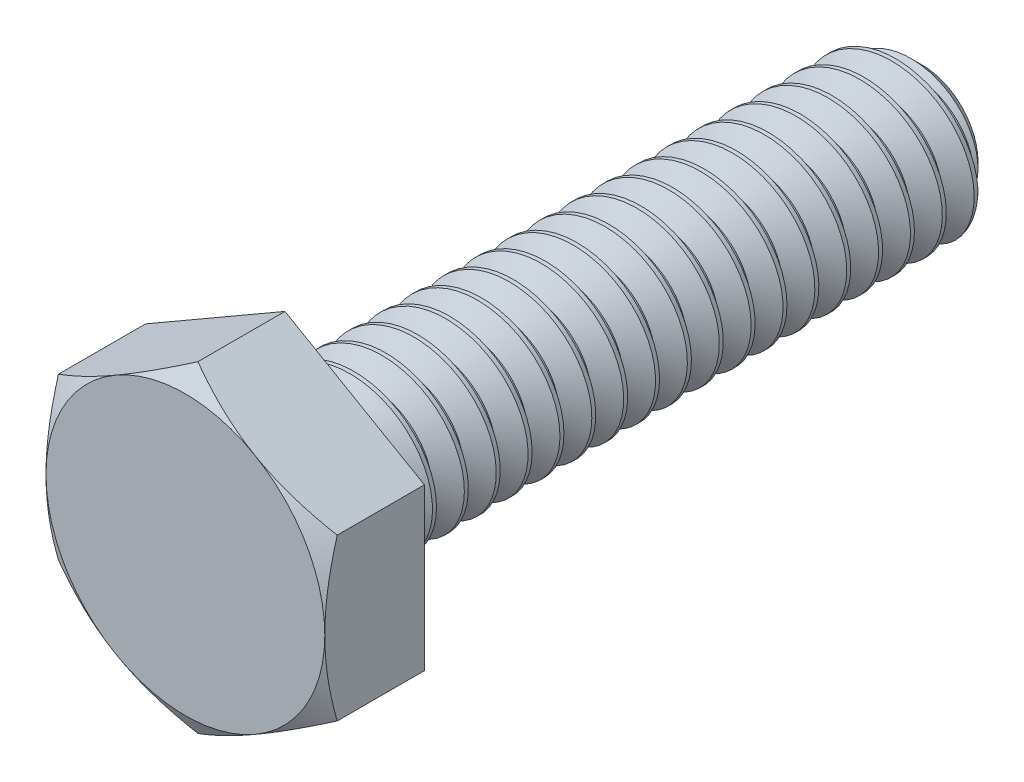
from build123d import *

# Parameters (mm, degrees)
SKETCH2_W           = 25.4
SKETCH2_H           = 3.175
BOSS_EXTRUDE1_DEPTH = 3.96875
CHAMFER1_SIZE       = 0.9525
SKETCH4_OUTSIDE_W   = 129.26
SKETCH4_OUTSIDE_H   = 130.98
SKETCH4_OUTSIDE_R   = 5.55625
CUT_EXTRUDE1_DEPTH  = 31.570540439
CUT_EXTRUDE1_DRAFT  = -60
CUT_SWEEP1_PITCH    = 1.27
CUT_SWEEP1_TO       = 25.4


with BuildPart() as part:
    # Sketch2 → Revolve1 (revolve)
    with BuildSketch(Plane(origin=(0, 0, 0), x_dir=(0, 0, -1), z_dir=(1, 0, 0)), mode=Mode.PRIVATE) as revolve1_sk:
        with Locations((12.7, 1.5875)):
            Rectangle(SKETCH2_W, SKETCH2_H)
    revolve(revolve1_sk.sketch.rotate(Axis((0, 0, 0), (0, 0, -1)), 90), axis=Axis((0, 0, 0), (0, 0, -1)))

    # Sketch3 → Boss-Extrude1 (add)
    with BuildSketch(Plane.XY):
        Polygon((0, 6.415804866), (-5.55625, 3.207902433), (-5.55625, -3.207902433), (0, -6.415804866), (5.55625, -3.207902433), (5.55625, 3.207902433), align=None)
    extrude(amount=BOSS_EXTRUDE1_DEPTH)

    # Chamfer1
    chamfer1_edges = [part.edges().sort_by_distance(p)[0] for p in [
        (-3.175, 0, -25.4),
    ]]
    chamfer(chamfer1_edges, length=CHAMFER1_SIZE)


with BuildPart() as cut_extrude1_tool:
    # Sketch4 outside → Cut-Extrude1 (with draft: the straight prism first)
    with BuildSketch(Plane.XY.offset(3.96875)):
        Rectangle(SKETCH4_OUTSIDE_W, SKETCH4_OUTSIDE_H)
        Circle(SKETCH4_OUTSIDE_R, mode=Mode.SUBTRACT)
    extrude(amount=-CUT_EXTRUDE1_DEPTH)
    # Cut-Extrude1: the draft: its side faces are tilted about the plane it starts from
    cut_extrude1_sides = [cut_extrude1_tool.faces().sort_by_distance(p)[0] for p in [
        (0, -65.49, -11.816520219),
        (64.63, 0, -11.816520219),
        (0, 65.49, -11.816520219),
        (-64.63, 0, -11.816520219),
        (-5.55625, 0, -11.816520219),
    ]]
    draft(cut_extrude1_sides, Plane.XY.offset(3.96875), CUT_EXTRUDE1_DRAFT)


with BuildPart() as part_1:
    add(part.part)

    # Cut-Extrude1: cut by cut_extrude1_tool
    add(cut_extrude1_tool.part, mode=Mode.SUBTRACT)


with BuildPart() as body_2:
    # Split1: read off the stored shape, not the designer's step
    # Split1: the piece on the far side of the plane
    add(part_1.part)
    split(bisect_by=Plane.XY, keep=Keep.BOTTOM)

    # Cut-Sweep1: arcs per turn and ends read off the stored shape
    # Cut-Sweep1: the profile of Sketch5 screwed along a right-hand helix through 21 turns, 8 arcs to a turn; built about Z, then put on its axis
    cut_sweep1_z = Axis((0, 0, 0), (0, 0, 1))
    cut_sweep1_corners = [(3.243740766, 0, 0.0396875), (3.243740766, 0, -1.1509375), (2.350110803, 0, -0.635), (2.350110803, 0, -0.47625)]
    with BuildLine(mode=Mode.PRIVATE) as cut_sweep1_profile:
        Line(cut_sweep1_corners[0], cut_sweep1_corners[1])
        Line(cut_sweep1_corners[1], cut_sweep1_corners[2])
        Line(cut_sweep1_corners[2], cut_sweep1_corners[3])
        Line(cut_sweep1_corners[3], cut_sweep1_corners[0])
    cut_sweep1_cap = Face(cut_sweep1_profile.wire())
    cut_sweep1_turn_angles = [0, 22.5, 45, 67.5, 90, 112.5, 135, 157.5, 180, 202.5, 225, 247.5, 270, 292.5, 315, 337.5, 360]
    cut_sweep1_turn_weights = [1, 0.9238795325112867, 1, 0.9238795325112867, 1, 0.9238795325112867, 1, 0.9238795325112867, 1, 0.9238795325112867, 1, 0.9238795325112867, 1, 0.9238795325112867, 1, 0.9238795325112867, 1]
    cut_sweep1_turn_rails = [Edge.make_bspline([Vector(p[0], p[1], 0).rotate(cut_sweep1_z, cut_sweep1_turn_angles[k]) / cut_sweep1_turn_weights[k] + Vector(0, 0, p[2] + CUT_SWEEP1_PITCH * cut_sweep1_turn_angles[k] / 360) for k in range(17)], [0, 0, 0, 1, 1, 2, 2, 3, 3, 4, 4, 5, 5, 6, 6, 7, 7, 8, 8, 8], 2, cut_sweep1_turn_weights) for p in cut_sweep1_corners]
    cut_sweep1_turn_sides = [Face.make_surface_from_curves(cut_sweep1_turn_rails[p[0]], cut_sweep1_turn_rails[p[1]]) for p in [(0, 1), (1, 2), (2, 3), (3, 0)]]
    cut_sweep1 = Plane(origin=(0, 0, -25.4), x_dir=(0, 1, 0), z_dir=(0, 0, 1)) * split(Solid(Shell([*[p.moved(Location((0, 0, CUT_SWEEP1_PITCH * i))) for i in range(21) for p in cut_sweep1_turn_sides], cut_sweep1_cap, cut_sweep1_cap.rotate(cut_sweep1_z, 7560).moved(Location((0, 0, CUT_SWEEP1_PITCH * 7560 / 360)))])), bisect_by=Plane.XY.offset(CUT_SWEEP1_TO), keep=Keep.BOTTOM, mode=Mode.PRIVATE)
    add(cut_sweep1, mode=Mode.SUBTRACT)


with BuildPart() as part_2:
    add(part_1.part)

    # Split1
    split(bisect_by=Plane.XY, keep=Keep.TOP)

    # Combine1: union body 2
    add(body_2.part)


solid = part_2.part
